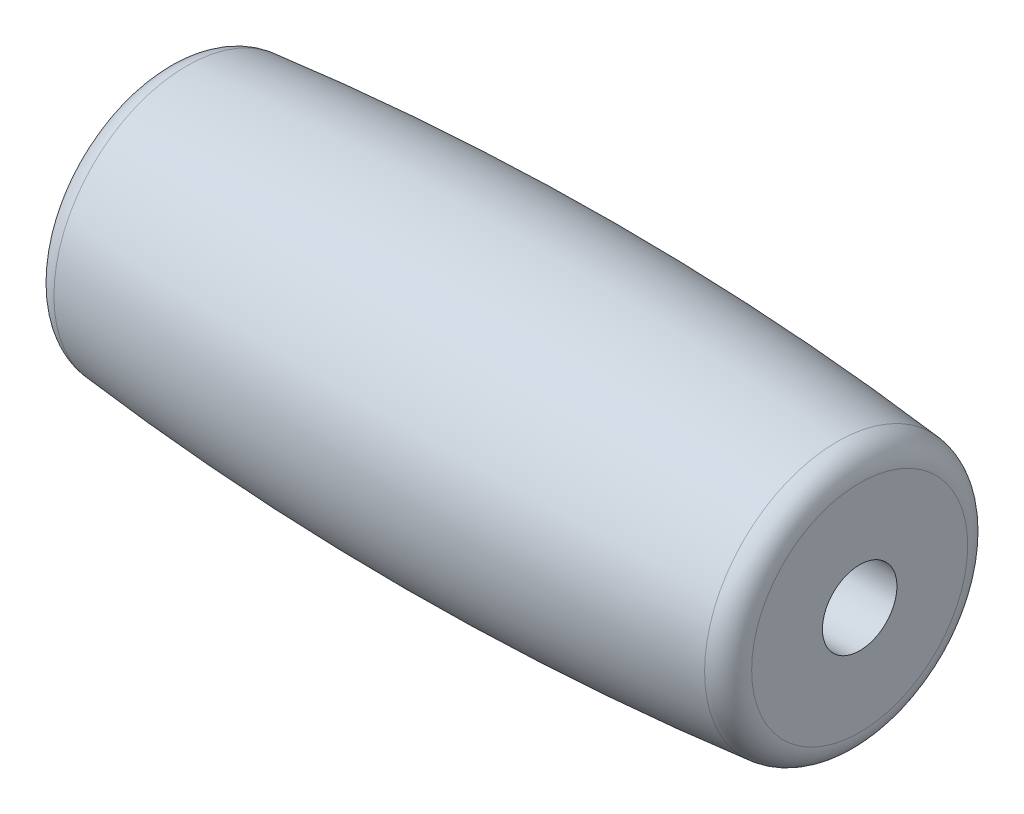
from build123d import *


with BuildPart() as part:
    # Sketch1 → Revolve1 (revolve)
    with BuildSketch(Plane.XY):
        with BuildLine():
            Line((-14, 1.5), (14, 1.5))
            Line((14, 1.5), (14, 4.35))
            ThreePointArc((14, 4.35), (13.741554051, 5.020893128), (13.099804821, 5.345007034))
            ThreePointArc((13.099804821, 5.345007034), (-9.0366e-05, 5.999999995), (-13.099913761, 5.343572766))
            ThreePointArc((-13.099913761, 5.343572766), (-13.741590777, 5.019429197), (-14, 4.348576665))
            Line((-14, 4.348576665), (-14, 1.5))
        make_face()
    revolve(axis=Axis((0, 0, 0), (1, 0, 0)))


solid = part.part
